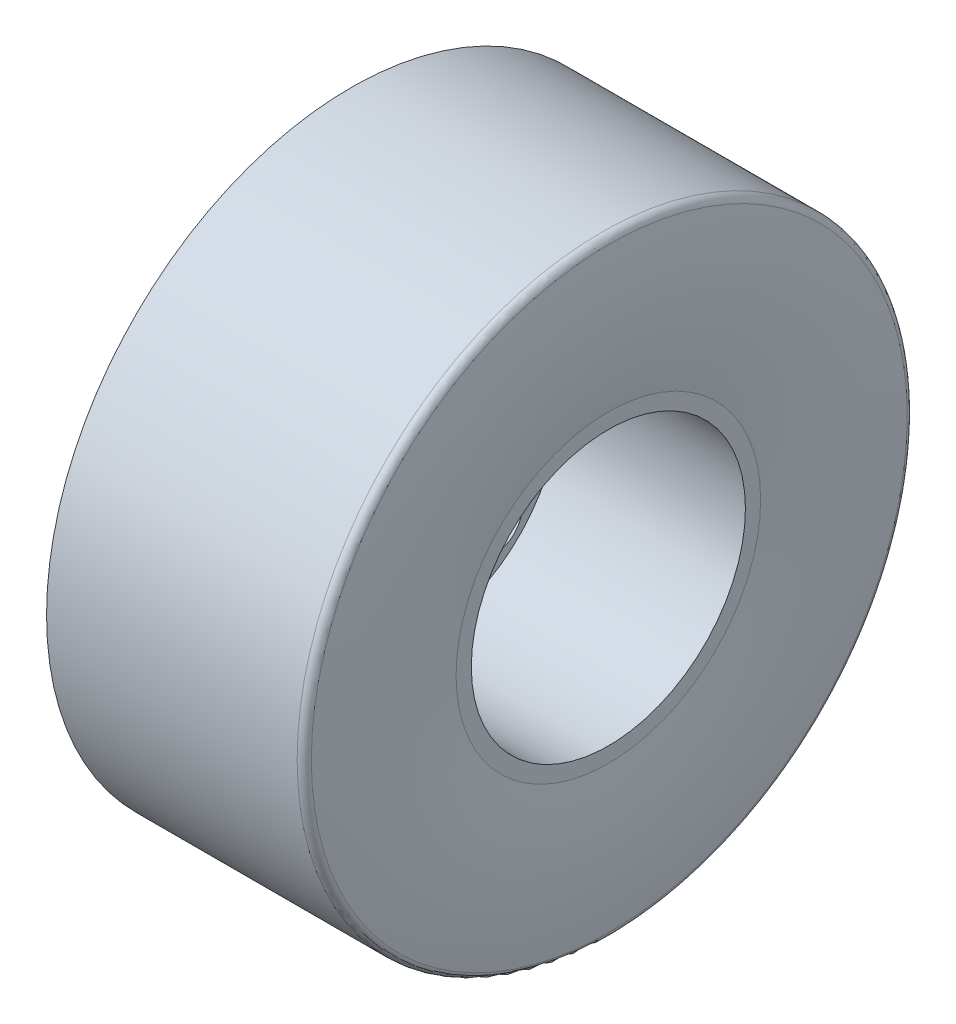
from build123d import *

# Parameters (mm, degrees)
SKETCH2_R                 = 3.175
EXTRUDE1_DEPTH            = 11.0925
SKETCH3_R                 = 4.5
EXTRUDE2_DEPTH            = 2
SKETCH4_R                 = 2.5
EXTRUDE3_DEPTH            = 2
SKETCH5_R                 = 1.8
CUT_EXTRUDE1_DEPTH        = 31.996490188
CIRPATTERN1_COUNT         = 8
SKETCH6_R                 = 1.63
CUT_EXTRUDE2_DEPTH        = 15.0925
SKETCH7_R                 = 0.5
EXTRUDE4_DEPTH            = 0.25
CIRPATTERN2_COUNT         = 10
RIB1_REACH                = 39.922
SKETCH8_WALL_W            = 82.95640457
SKETCH8_WALL_H            = 1
EXTRUDE5_REACH            = 34.625
EXTRUDE5_END_MAJOR_RADIUS = 15
EXTRUDE5_END_MINOR_RADIUS = 33.4125
SKETCH9_R                 = 1.125
CIRPATTERN3_COUNT         = 6


# Read off the part's stored shape, not the designer's step: Shell1
with BuildPart() as part:
    # Sketch1 → Revolve1 (revolve)
    with BuildSketch(Plane.XY, mode=Mode.PRIVATE) as revolve1_sk:
        with BuildLine():
            Line((12.68, 9), (24.901016151, 9))
            Line((24.901016151, 9), (24.901016151, 10))
            ThreePointArc((24.901016151, 10), (25.259312019, 14.780550163), (24.960991199, 19.565217391))
            ThreePointArc((24.960991199, 19.565217391), (24.79495299, 19.875904706), (24.465262753, 20))
            Line((24.465262753, 20), (8.01, 20))
            Line((8.01, 20), (8.01, 0))
            Line((8.01, 0), (12.68, 0))
            Line((12.68, 0), (12.68, 9))
        make_face()
    revolve(revolve1_sk.sketch.rotate(Axis((0, 0, 0), (1, 0, 0)), 90), axis=Axis((0, 0, 0), (1, 0, 0)))

    # Shell1 outline → Shell1 (revolve, cut)
    with BuildSketch(Plane.YX):
        with BuildLine():
            Line((10.5875, 11.0925), (0, 11.0925))
            Line((0, 11.0925), (0, 8.01))
            Line((0, 8.01), (18.4125, 8.01))
            Line((18.4125, 8.01), (18.4125, 23.497779709))
            ThreePointArc((18.4125, 23.497779709), (14.496535625, 23.668706648), (10.5875, 23.379858091))
            Line((10.5875, 23.379858091), (10.5875, 11.0925))
        make_face()
    revolve(axis=Axis((0, 0, 0), (1, 0, 0)), mode=Mode.SUBTRACT)

    # Sketch2 → Extrude1 (add)
    with BuildSketch(Plane.ZY.offset(-11.0925)):
        with Locations(Location((0, 0, 0), (0, 0, 180))):
            Circle(SKETCH2_R)
    extrude(amount=EXTRUDE1_DEPTH)

    # Sketch3 → Extrude2 (add)
    with BuildSketch(Plane(origin=(12.68, 0, 0), x_dir=(0, 0, -1), z_dir=(1, 0, 0))):
        with Locations(Location((0, 0, 0), (0, 0, 180))):
            Circle(SKETCH3_R)
    extrude(amount=EXTRUDE2_DEPTH)

    # Sketch4 → Extrude3 (add)
    with BuildSketch(Plane(origin=(14.68, 0, 0), x_dir=(0, 0, -1), z_dir=(1, 0, 0))):
        Circle(SKETCH4_R)
    extrude(amount=EXTRUDE3_DEPTH)

    # Sketch5 → Cut-Extrude1 (cut, through all)
    with BuildSketch(Plane(origin=(12.68, 0, 0), x_dir=(0, 0, -1), z_dir=(1, 0, 0))):
        with Locations((0, 6.75)):
            Circle(SKETCH5_R)
    cut_extrude1 = extrude(amount=-CUT_EXTRUDE1_DEPTH, mode=Mode.SUBTRACT)

    # CirPattern1: Cut-Extrude1 ×8 about axis
    cirpattern1_axis = Axis((0, 0, 0), (1, 0, 0))
    for i in range(1, CIRPATTERN1_COUNT):
        add(cut_extrude1.rotate(cirpattern1_axis, i * 360 / CIRPATTERN1_COUNT), mode=Mode.SUBTRACT)

    # Sketch6 → Cut-Extrude2 (cut)
    with BuildSketch(Plane.ZY):
        Circle(SKETCH6_R)
    extrude(amount=-CUT_EXTRUDE2_DEPTH, mode=Mode.SUBTRACT)

    # Sketch7 → Extrude4 (add)
    with BuildSketch(Plane(origin=(14.68, 0, 0), x_dir=(0, 0, -1), z_dir=(1, 0, 0))):
        with Locations((0, 3.5)):
            Circle(SKETCH7_R)
    extrude4 = extrude(amount=EXTRUDE4_DEPTH)

    # CirPattern2: Extrude4 ×10 about axis
    cirpattern2_axis = Axis((0, 0, 0), (1, 0, 0))
    for i in range(1, CIRPATTERN2_COUNT):
        add(extrude4.rotate(cirpattern2_axis, i * 360 / CIRPATTERN2_COUNT))

    # Sketch8 wall → Rib1 (add, up to next)
    with BuildSketch(Plane(origin=(16.26, 0, -14.665321224), x_dir=(0, 0, 1), z_dir=(1, 0, 0)), mode=Mode.PRIVATE) as rib1_sk1:
        Rectangle(SKETCH8_WALL_W, SKETCH8_WALL_H)
    rib1_tool1 = extrude(rib1_sk1.sketch, amount=RIB1_REACH, mode=Mode.PRIVATE) - part.part
    rib1 = rib1_tool1.solids().sort_by_distance((16.26, 0, -14.665321224))[0]
    add(rib1)

    # Extrude5: up to this torus (the profile starts inside it)
    extrude5_end = Plane(origin=(-9.74, 0, 0), z_dir=(-1, 0, 0)) * Torus(EXTRUDE5_END_MAJOR_RADIUS, EXTRUDE5_END_MINOR_RADIUS, mode=Mode.PRIVATE)
    # Sketch9 → Extrude5 (add, up to the surface)
    with BuildSketch(Plane.ZY.offset(-16.26), mode=Mode.PRIVATE) as extrude5_sk1:
        with Locations((-14.5, 0)):
            Circle(SKETCH9_R)
    extrude5_tool1 = extrude(extrude5_sk1.sketch, amount=-EXTRUDE5_REACH, mode=Mode.PRIVATE) & extrude5_end
    extrude5 = extrude5_tool1.solids().sort_by_distance((16.26, 0, -14.5))[0]
    add(extrude5)

    # CirPattern3: Rib1, Extrude5 ×6 about axis
    cirpattern3_axis = Axis((0, 0, 0), (1, 0, 0))
    add([rib1.rotate(cirpattern3_axis, i * 360 / CIRPATTERN3_COUNT) for i in range(1, CIRPATTERN3_COUNT)])
    add([extrude5.rotate(cirpattern3_axis, i * 360 / CIRPATTERN3_COUNT) for i in range(1, CIRPATTERN3_COUNT)])


solid = part.part
